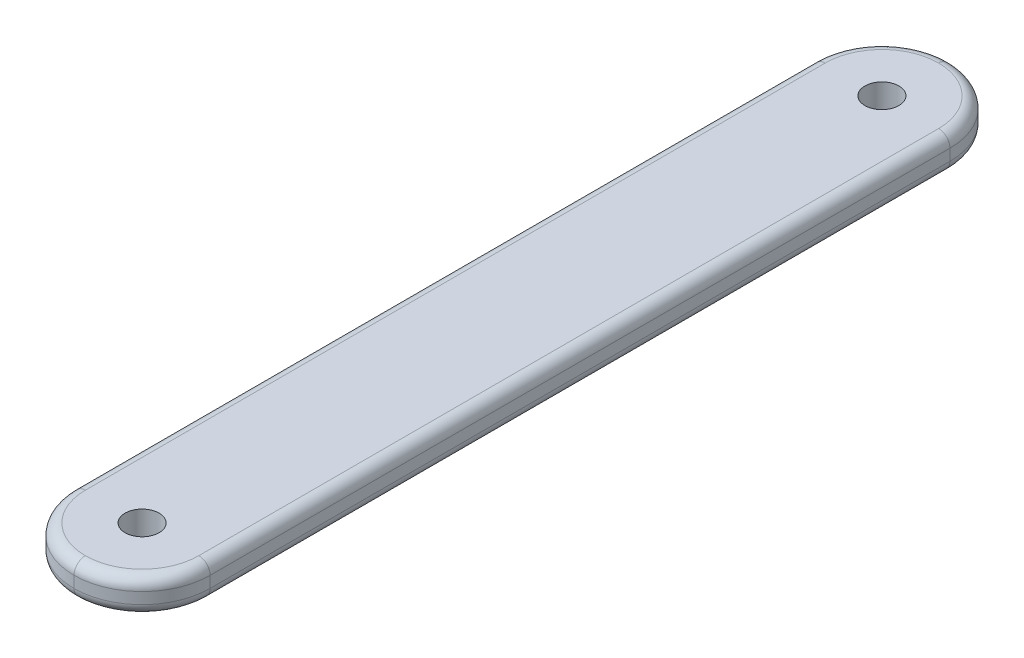
from build123d import *

# Parameters (mm, degrees)
SKETCH1_W           = 25.4
SKETCH1_H           = 163.454078658
SKETCH1_R           = 3.175
BOSS_EXTRUDE1_DEPTH = 6.35
FILLET2_R           = 12.7
FILLET3_R           = 2.116666667


with BuildPart() as part:
    # Sketch1 → Boss-Extrude1 (new body)
    with BuildSketch(Plane(origin=(0, 0, 0), x_dir=(1, 0, 0), z_dir=(0, 1, 0))):
        Rectangle(SKETCH1_W, SKETCH1_H)
        with Locations(Location((0, -69.027039329, 0), (0, 0, 270))):
            Circle(SKETCH1_R, mode=Mode.SUBTRACT)
        with Locations(Location((0, 69.027039329, 0), (0, 0, 270))):
            Circle(SKETCH1_R, mode=Mode.SUBTRACT)
    extrude(amount=BOSS_EXTRUDE1_DEPTH)

    # Fillet2
    fillet2_edges = [part.edges().sort_by_distance(p)[0] for p in [
        (-12.7, 3.175, -81.727039329),
        (12.7, 3.175, -81.727039329),
        (-12.7, 3.175, 81.727039329),
        (12.7, 3.175, 81.727039329),
    ]]
    fillet(fillet2_edges, radius=FILLET2_R - 0.0001)  # a hair under: the kernel refuses the full size

    # Fillet3
    fillet3_edges = [part.edges().sort_by_distance(p)[0] for p in [
        (-12.7, 0, 0),
        (-12.7, 6.35, 0),
        (12.7, 0, 0),
        (8.98028541, 0, 78.007324739),
        (-8.98028541, 0, 78.007324739),
        (8.98028541, 0, -78.007324739),
        (-8.98028541, 0, -78.007324739),
        (12.7, 6.35, 0),
        (8.98028541, 6.35, 78.007324739),
        (-8.98028541, 6.35, 78.007324739),
        (8.98028541, 6.35, -78.007324739),
        (-8.98028541, 6.35, -78.007324739),
    ]]
    fillet(fillet3_edges, radius=FILLET3_R)


solid = part.part
